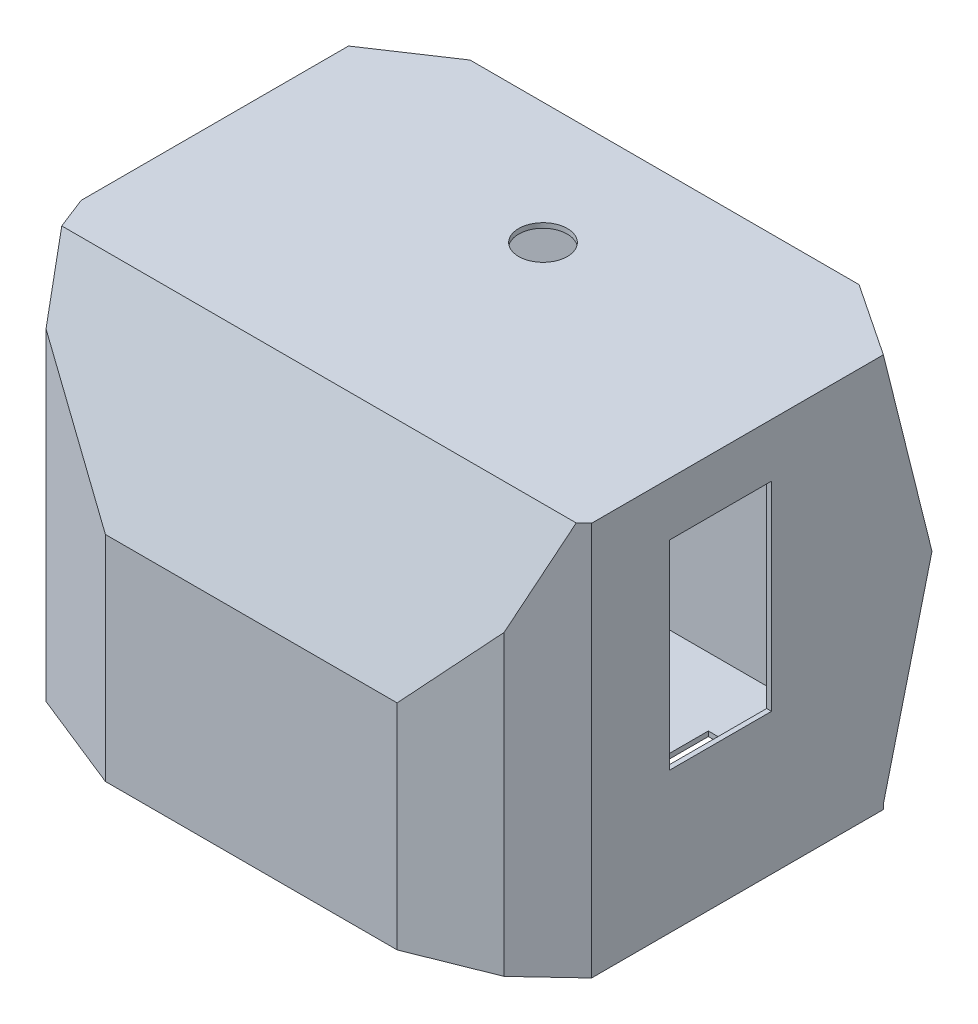
from build123d import *
from OCP.BRepFilletAPI import BRepFilletAPI_MakeChamfer

# Parameters (mm, degrees)
SKETCH_1_W                 = 110
SKETCH_1_H                 = 85
EXTRUDE_1_DEPTH            = 80
CUT_EXTRUDE_1_REACH        = 162.39
CHAMFER_1_SIZE             = 5
CHAMFER_1_SIZE2            = 10
SPLIT_START                = 61.095980997
SPLIT_BODIES_3_OUTLINE_W   = 98
SPLIT_BODIES_3_OUTLINE_H   = 75
SPLIT_BODIES_3_DEPTH       = 8.1461308
SPLIT_START_2              = -128.980404327
SPLIT_BODIES_3_2_OUTLINE_W = 98
SPLIT_BODIES_3_2_OUTLINE_H = 75
SPLIT_BODIES_3_2_DEPTH     = 8.146130799
SPLIT_START_3              = -145.272665927
SPLIT_BODIES_3_3_OUTLINE_W = 98
SPLIT_BODIES_3_3_OUTLINE_H = 76
SPLIT_BODIES_3_3_DEPTH     = 8.1461308
SPLIT_START_4              = 77.388242596
SPLIT_BODIES_3_4_OUTLINE_W = 99
SPLIT_BODIES_3_4_OUTLINE_H = 76
SPLIT_BODIES_3_4_DEPTH     = 8.1461308
SHELL_2_T                  = -1
SKETCH_6_R                 = 5
CUT_EXTRUDE_2_DEPTH        = 10
SKETCH_7_W                 = 21
SKETCH_7_H                 = 41
CUT_EXTRUDE_3_DEPTH        = 161.390149323
EXTRUDE_2_DEPTH            = 1
SKETCH_9_W                 = 21
SKETCH_9_H                 = 41
CUT_EXTRUDE_5_DEPTH        = 1


# Read off the part's stored shape, not the designer's step: 分割3
with BuildPart() as part:
    # 草图1 → 凸台-拉伸1 (new body)
    with BuildSketch(Plane(origin=(0, 0, 0), x_dir=(1, 0, 0), z_dir=(0, 1, 0))):
        with Locations((-55, 42.5)):
            Rectangle(SKETCH_1_W, SKETCH_1_H)
    extrude(amount=EXTRUDE_1_DEPTH)

    # 草图2 → 切除-拉伸1 (cut, up to next)
    with BuildSketch(Plane(origin=(0, 80, 0), x_dir=(1, 0, 0), z_dir=(0, 1, 0)), mode=Mode.PRIVATE) as cut_extrude_1_sk1:
        Polygon((-85, 0), (-110, 10), (-110, 0), align=None)
    cut_extrude_1_tool1 = extrude(cut_extrude_1_sk1.sketch, amount=-CUT_EXTRUDE_1_REACH, mode=Mode.PRIVATE) & part.part
    # 草图2 → 切除-拉伸1 (cut, up to next)
    with BuildSketch(Plane(origin=(0, 80, 0), x_dir=(1, 0, 0), z_dir=(0, 1, 0)), mode=Mode.PRIVATE) as cut_extrude_1_sk2:
        Polygon((0, 10), (-25, 0), (0, 0), align=None)
    cut_extrude_1_tool2 = extrude(cut_extrude_1_sk2.sketch, amount=-CUT_EXTRUDE_1_REACH, mode=Mode.PRIVATE) & part.part
    add(cut_extrude_1_tool1.solids().sort_by_distance((-101.666667, 80, -3.333333))[0], mode=Mode.SUBTRACT)
    add(cut_extrude_1_tool2.solids().sort_by_distance((-8.333333, 80, -3.333333))[0], mode=Mode.SUBTRACT)

    # Split Bodies 2
    split(bisect_by=Plane(origin=(0, 5.030044473, 13.819933608), x_dir=(0, 0.9396926207859094, -0.3420201433256661), z_dir=(0, 0.3420201433256661, 0.9396926207859094)), keep=Keep.BOTTOM)

    # 倒角1: one chamfer whose edges measure the first distance from different faces: ONE call of the kernel's chamfer builder (chamfer() names one face for all edges)
    chamfer_1_edges_1 = [part.edges().sort_by_distance(p)[0] for p in [
        (-110, 35.237387097, -10),
    ]]
    chamfer_1_side_1 = [part.faces().sort_by_distance(p)[0] for p in [
        (-98.508842949, 28.923048193, -5.40353718),
    ]]
    chamfer_1_edges_2 = [part.edges().sort_by_distance(p)[0] for p in [
        (0, 35.237387097, -10),
    ]]
    chamfer_1_side_2 = [part.faces().sort_by_distance(p)[0] for p in [
        (0, 39.898381252, -47.600292644),
    ]]
    chamfer_1 = BRepFilletAPI_MakeChamfer(part.part.solid().wrapped)
    for e in chamfer_1_edges_1:
        chamfer_1.Add(CHAMFER_1_SIZE, CHAMFER_1_SIZE2, e.wrapped, chamfer_1_side_1[0].wrapped)  # the first distance lies on this face
    for e in chamfer_1_edges_2:
        chamfer_1.Add(CHAMFER_1_SIZE, CHAMFER_1_SIZE2, e.wrapped, chamfer_1_side_2[0].wrapped)  # the first distance lies on this face
    add(Compound.cast(chamfer_1.Shape()), mode=Mode.REPLACE)

    # Split Bodies 3 outline → Split Bodies 3 (cut)
    with BuildSketch(Plane(origin=(0, 0, 0), x_dir=(0.839683943173837, 0.13171512834099375, 0.5268605133639755), z_dir=(0.5430753866417041, -0.20365326999063904, -0.8146130799625572)).offset(SPLIT_START)):
        with Locations((-79, -54.5)):
            Rectangle(SPLIT_BODIES_3_OUTLINE_W, SPLIT_BODIES_3_OUTLINE_H)
    extrude(amount=SPLIT_BODIES_3_DEPTH, mode=Mode.SUBTRACT)

    # Split Bodies 3 2 outline → Split Bodies 3 2 (cut)
    with BuildSketch(Plane(origin=(0, 0, 0), x_dir=(0.8396839431738365, -0.13171512834099394, -0.5268605133639763), z_dir=(0.5430753866417047, 0.20365326999063899, 0.8146130799625568)).offset(SPLIT_START_2)):
        with Locations((-13, 54.5)):
            Rectangle(SPLIT_BODIES_3_2_OUTLINE_W, SPLIT_BODIES_3_2_OUTLINE_H)
    extrude(amount=SPLIT_BODIES_3_2_DEPTH, mode=Mode.SUBTRACT)

    # Split Bodies 3 3 outline → Split Bodies 3 3 (cut)
    with BuildSketch(Plane(origin=(0, 0, 0), x_dir=(0.8396839431738365, 0.13171512834099394, -0.5268605133639763), z_dir=(0.5430753866417047, -0.20365326999063899, 0.8146130799625568)).offset(SPLIT_START_3)):
        with Locations((-2, 23)):
            Rectangle(SPLIT_BODIES_3_3_OUTLINE_W, SPLIT_BODIES_3_3_OUTLINE_H)
    extrude(amount=SPLIT_BODIES_3_3_DEPTH, mode=Mode.SUBTRACT)

    # Split Bodies 3 4 outline → Split Bodies 3 4 (cut)
    with BuildSketch(Plane(origin=(0, 0, 0), x_dir=(0.839683943173837, -0.13171512834099375, 0.5268605133639755), z_dir=(0.5430753866417041, 0.20365326999063904, -0.8146130799625572)).offset(SPLIT_START_4)):
        with Locations((-89.5, -23)):
            Rectangle(SPLIT_BODIES_3_4_OUTLINE_W, SPLIT_BODIES_3_4_OUTLINE_H)
    extrude(amount=SPLIT_BODIES_3_4_DEPTH, mode=Mode.SUBTRACT)

    # 抽壳2
    shell_2_openings = [part.faces().sort_by_distance(p)[0] for p in [
        (-54.995965718, 0, -43.10116127),
    ]]
    offset(amount=SHELL_2_T, openings=shell_2_openings, kind=Kind.INTERSECTION)

    # 草图6 → 切除-拉伸2 (cut)
    with BuildSketch(Plane(origin=(0, 80, 0), x_dir=(1, 0, 0), z_dir=(0, 1, 0))):
        with Locations(Location((-55, 60, 0), (0, 0, 270))):
            Circle(SKETCH_6_R)
    extrude(amount=-CUT_EXTRUDE_2_DEPTH, mode=Mode.SUBTRACT)

    # 草图7 → 切除-拉伸3 (cut, through all)
    with BuildSketch(Plane(origin=(0, 0, 0), x_dir=(0, 0, -1), z_dir=(1, 0, 0))):
        with Locations((41.5, 48.5)):
            Rectangle(SKETCH_7_W, SKETCH_7_H)
    extrude(amount=-CUT_EXTRUDE_3_DEPTH, mode=Mode.SUBTRACT)

    # 草图8 → 凸台-拉伸2 (add)
    with BuildSketch(Plane.XZ):
        Polygon((-110, -75), (-95, -85), (-15, -85), (0, -75), (0, -15), (-9.284766909, -6.286093236), (-25, 0), (-85, 0), (-105.357616546, -8.143046618), (-110, -20), align=None)
    extrude(amount=EXTRUDE_2_DEPTH)

    # 草图9 → 切除-拉伸5 (cut)
    with BuildSketch(Plane.XZ.offset(1)):
        with Locations((-20.5, -49.5)):
            Rectangle(SKETCH_9_W, SKETCH_9_H)
        with Locations((-89.5, -49.5)):
            Rectangle(SKETCH_9_W, SKETCH_9_H)
    extrude(amount=-CUT_EXTRUDE_5_DEPTH, mode=Mode.SUBTRACT)


solid = part.part
